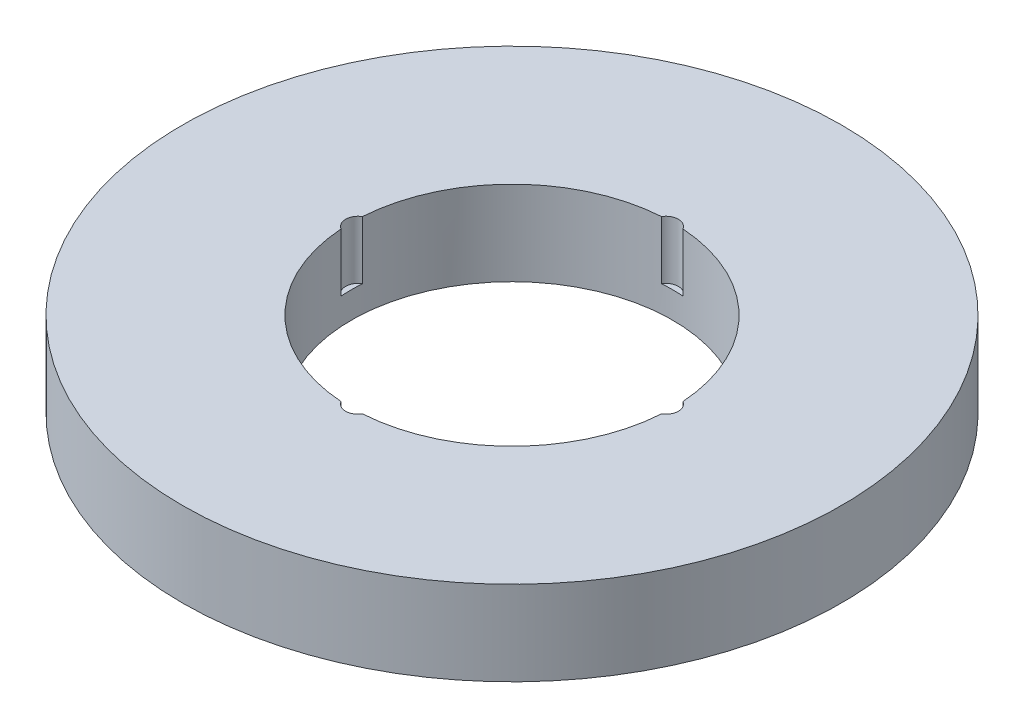
from build123d import *

# Parameters (mm, degrees)
SKETCH1_R           = 97.5
BOSS_EXTRUDE1_DEPTH = 25
SKETCH2_R           = 47.5
CUT_EXTRUDE1_DEPTH  = 141.133864572
SKETCH3_R           = 3.670995235
CUT_EXTRUDE2_DEPTH  = 17.204444502
CIRPATTERN1_COUNT   = 4


with BuildPart() as part:
    # Sketch1 → Boss-Extrude1 (new body)
    with BuildSketch(Plane(origin=(0, 0, 0), x_dir=(1, 0, 0), z_dir=(0, 1, 0))):
        Circle(SKETCH1_R)
    extrude(amount=BOSS_EXTRUDE1_DEPTH)

    # Sketch2 → Cut-Extrude1 (cut, through all)
    with BuildSketch(Plane(origin=(0, 0, 0), x_dir=(1, 0, 0), z_dir=(0, 1, 0))):
        Circle(SKETCH2_R)
    extrude(amount=CUT_EXTRUDE1_DEPTH, mode=Mode.SUBTRACT)

    # Sketch3 → Cut-Extrude2 (cut)
    with BuildSketch(Plane(origin=(0, 25, 0), x_dir=(1, 0, 0), z_dir=(0, 1, 0))):
        with Locations((-45.538487006, 0)):
            Circle(SKETCH3_R)
    cut_extrude2 = extrude(amount=-CUT_EXTRUDE2_DEPTH, mode=Mode.SUBTRACT)

    # CirPattern1: Cut-Extrude2 ×4 about axis
    cirpattern1_axis = Axis((0, 0, 0), (0, 1, 0))
    for i in range(1, CIRPATTERN1_COUNT):
        add(cut_extrude2.rotate(cirpattern1_axis, i * 360 / CIRPATTERN1_COUNT), mode=Mode.SUBTRACT)


solid = part.part
